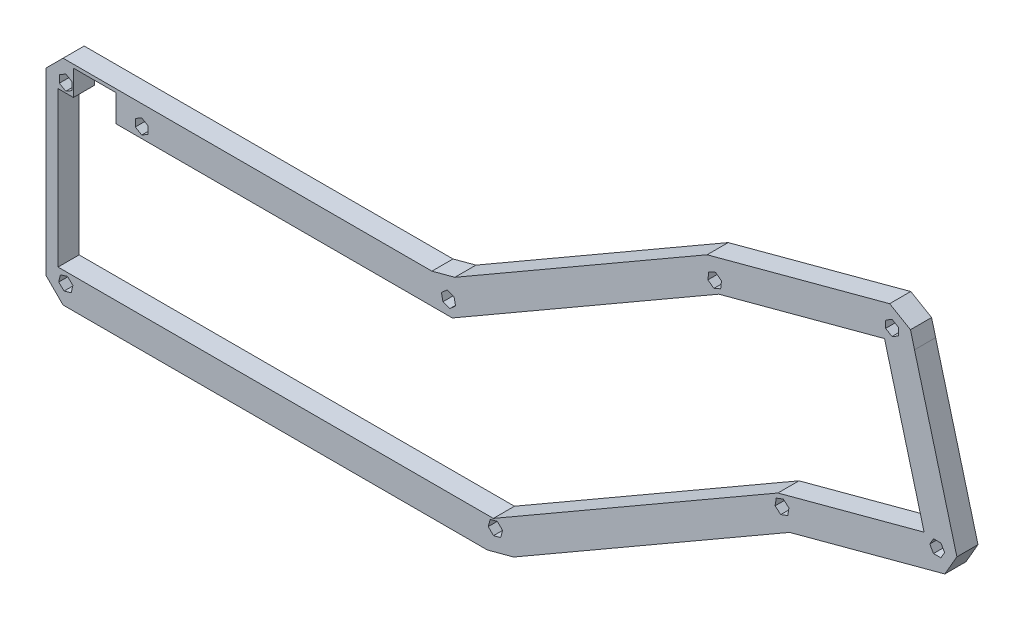
from build123d import *

# Parameters (mm, degrees)
BOSS_EXTRU_1_DEPTH = 8


with BuildPart() as part:
    # Esquisse1 → Boss.-Extru.1 (new body)
    with BuildSketch(Plane.XY):
        Polygon((-75.988646329, 51.585106383), (-76.753762562, 51.585106383), (-92.861789188, 51.585106383), (-94.860830925, 51.585106383), (-96.789296468, 51.585106383), (-103.253762562, 45.120640289), (-103.253762562, 35.79522772), (-103.253762562, -22.950427523), (-96.789296468, -29.414893617), (63.997857106, -29.414893617), (73.963816863, -26.744522748), (178.515758799, 33.618569072), (237.335031683, 49.379145741), (241.906099495, 57.296467436), (230.508864659, 99.83152691), (225.851857518, 117.211714172), (224.321712805, 123.047343228), (216.426306891, 127.634040432), (210.540810955, 126.057026548), (147.250925797, 109.098552931), (51.669750275, 53.914735514), (42.975455994, 51.585106383), align=None)
        Polygon((-95.09515421, -19.181421764), (-93.057202321, -21.118529255), (-93.715810673, -23.852001108), (-96.412370914, -24.64836547), (-98.450322803, -22.71125798), (-97.791714451, -19.977786126), align=None, mode=Mode.SUBTRACT)
        Polygon((67.767414571, -18.119374886), (69.755583746, -20.107544061), (69.027863321, -22.82343366), (66.311973721, -23.551154085), (64.323804547, -21.56298491), (65.051524972, -18.847095311), align=None, mode=Mode.SUBTRACT)
        Polygon((-93.318762562, 45.490954288), (-93.318762562, 42.679258478), (-95.753762562, 41.273410572), (-98.188762562, 42.679258478), (-98.188762562, 45.490954288), (-95.753762562, 46.896802194), align=None, mode=Mode.SUBTRACT)
        Polygon((-66.988646329, 46.896802194), (-64.553646329, 45.490954288), (-64.553646329, 42.679258478), (-66.988646329, 41.273410572), (-69.423646329, 42.679258478), (-69.423646329, 45.490954288), align=None, mode=Mode.SUBTRACT)
        Polygon((51.366225237, 47.372350111), (51.931744927, 44.618113227), (49.829265662, 42.751240367), (47.161266708, 43.638604392), (46.595747018, 46.392841276), (48.698226283, 48.259714136), align=None, mode=Mode.SUBTRACT)
        Polygon((-76.753762562, 40.085106383), (2.011353671, 40.085106383), (50.71612997, 40.085106383), (151.689760112, 98.382258927), (214.4831558, 115.207698591), (229.494660416, 59.184000666), (174.076924484, 44.334863077), (66.257183131, -17.914893617), (-98.698564415, -17.914893617), (-98.698564415, 40.655573641), (-94.860830925, 40.655573641), (-92.861789188, 40.655573641), (-92.861789188, 48.636078378), (-92.861789188, 50.298812036), (-76.753762562, 50.298812036), (-76.753762562, 48.636078378), align=None, mode=Mode.SUBTRACT)
        Polygon((176.099626255, 43.341034088), (178.27036991, 41.553995947), (177.808121311, 38.780557726), (175.175129056, 37.794157645), (173.004385401, 39.581195786), (173.466634, 42.354634007), align=None, mode=Mode.SUBTRACT)
        Polygon((235.851309069, 58.804459007), (237.257156975, 56.369459007), (235.851309069, 53.934459007), (233.039613258, 53.934459007), (231.633765353, 56.369459007), (233.039613258, 58.804459007), align=None, mode=Mode.SUBTRACT)
        Polygon((150.436891261, 104.94434728), (152.703485209, 103.280560873), (152.395900888, 100.48573973), (149.821722619, 99.354704995), (147.555128671, 101.018491402), (147.862712992, 103.813312544), align=None, mode=Mode.SUBTRACT)
        Polygon((219.824270363, 121.480626406), (219.771686266, 118.66942235), (217.310820089, 117.309359486), (214.90253801, 118.760500678), (214.955122108, 121.571704735), (217.415988284, 122.931767598), align=None, mode=Mode.SUBTRACT)
    extrude(amount=BOSS_EXTRU_1_DEPTH)


solid = part.part
